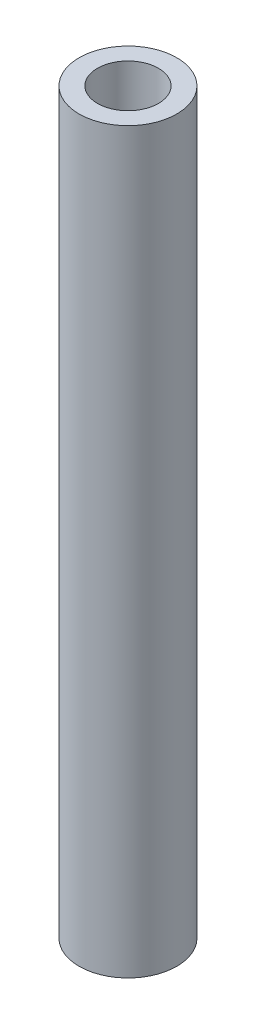
from build123d import *

# Parameters (mm, degrees)
SZKIC1_R                    = 4
SZKIC1_R_2                  = 2.5
DODANIE_WYCI_GNI_CIE1_DEPTH = 60.5


with BuildPart() as part:
    # Szkic1 → Dodanie-wyciągnięcie1 (new body)
    with BuildSketch(Plane(origin=(0, 0, 0), x_dir=(1, 0, 0), z_dir=(0, 1, 0))):
        with Locations((-3.443725343, 0)):
            Circle(SZKIC1_R)
        with Locations((-3.443725343, 0)):
            Circle(SZKIC1_R_2, mode=Mode.SUBTRACT)
    extrude(amount=DODANIE_WYCI_GNI_CIE1_DEPTH)


solid = part.part
